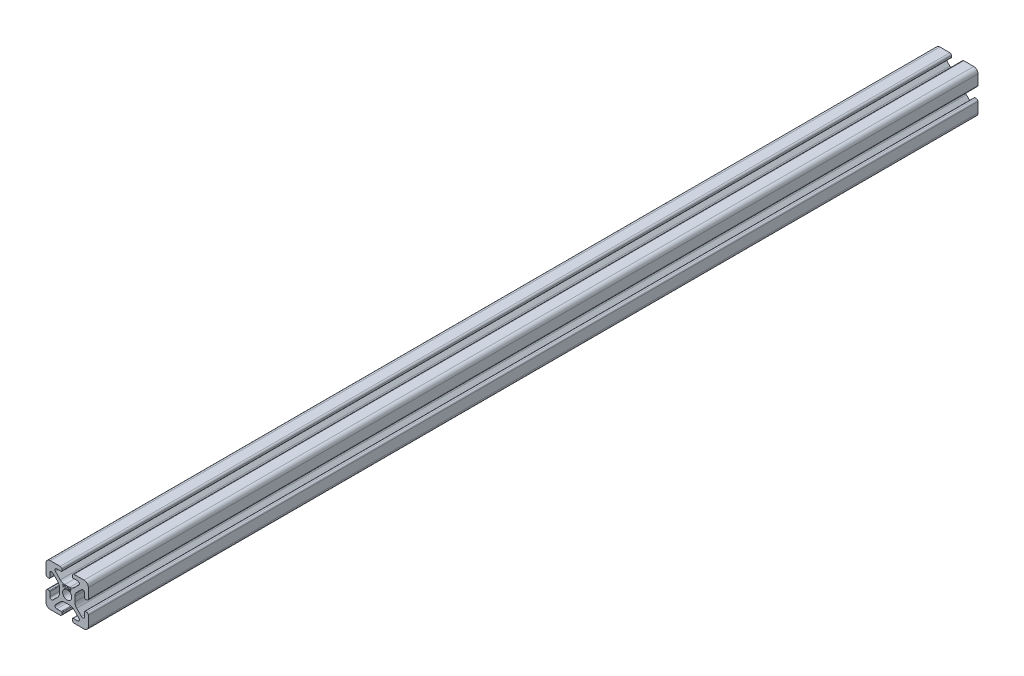
from build123d import *

# Parameters (mm, degrees)
SKETCH1_R           = 2.1463
BOSS_EXTRUDE1_DEPTH = 420
WRAP1_DEPTH         = 0.1


# Read off the part's stored shape, not the designer's step: Wrap1
with BuildPart() as part:
    # Sketch1 → Boss-Extrude1 (new body)
    with BuildSketch(Plane.XY):
        with BuildLine():
            Line((-9.9949, 7.9883), (-9.9949, 3.2893))
            ThreePointArc((-9.9949, 3.2893), (-9.76427588, 2.73252412), (-9.2075, 2.5019))
            Line((-9.2075, 2.5019), (-8.4963, 2.5019))
            ThreePointArc((-8.4963, 2.5019), (-8.280773853, 2.591173853), (-8.1915, 2.8067))
            Line((-8.1915, 2.8067), (-8.1915, 4.9149))
            ThreePointArc((-8.1915, 4.9149), (-7.674065253, 5.689295824), (-6.760603096, 5.507596904))
            Line((-6.760603096, 5.507596904), (-4.505765747, 3.252759555))
            ThreePointArc((-4.505765747, 3.252759555), (-3.856054457, 2.280397894), (-3.627906192, 1.133419111))
            Line((-3.627906192, 1.133419111), (-3.627906192, -1.133419111))
            ThreePointArc((-3.627906192, -1.133419111), (-3.856054457, -2.280397894), (-4.505765747, -3.252759555))
            Line((-4.505765747, -3.252759555), (-6.760603096, -5.507596904))
            ThreePointArc((-6.760603096, -5.507596904), (-7.674065253, -5.689295824), (-8.1915, -4.9149))
            Line((-8.1915, -4.9149), (-8.1915, -2.8067))
            ThreePointArc((-8.1915, -2.8067), (-8.280773853, -2.591173853), (-8.4963, -2.5019))
            Line((-8.4963, -2.5019), (-9.2075, -2.5019))
            ThreePointArc((-9.2075, -2.5019), (-9.76427588, -2.73252412), (-9.9949, -3.2893))
            Line((-9.9949, -3.2893), (-9.9949, -7.9883))
            ThreePointArc((-9.9949, -7.9883), (-9.407180467, -9.407180467), (-7.9883, -9.9949))
            Line((-7.9883, -9.9949), (-3.2893, -9.9949))
            ThreePointArc((-3.2893, -9.9949), (-2.73252412, -9.76427588), (-2.5019, -9.2075))
            Line((-2.5019, -9.2075), (-2.5019, -8.4963))
            ThreePointArc((-2.5019, -8.4963), (-2.591173853, -8.280773853), (-2.8067, -8.1915))
            Line((-2.8067, -8.1915), (-4.9149, -8.1915))
            ThreePointArc((-4.9149, -8.1915), (-5.689295824, -7.674065253), (-5.507596904, -6.760603096))
            Line((-5.507596904, -6.760603096), (-3.252759555, -4.505765747))
            ThreePointArc((-3.252759555, -4.505765747), (-2.280397894, -3.856054457), (-1.133419111, -3.627906192))
            Line((-1.133419111, -3.627906192), (1.133419111, -3.627906192))
            ThreePointArc((1.133419111, -3.627906192), (2.280397894, -3.856054457), (3.252759555, -4.505765747))
            Line((3.252759555, -4.505765747), (5.507596904, -6.760603096))
            ThreePointArc((5.507596904, -6.760603096), (5.689295824, -7.674065253), (4.9149, -8.1915))
            Line((4.9149, -8.1915), (2.8067, -8.1915))
            ThreePointArc((2.8067, -8.1915), (2.591173853, -8.280773853), (2.5019, -8.4963))
            Line((2.5019, -8.4963), (2.5019, -9.2075))
            ThreePointArc((2.5019, -9.2075), (2.73252412, -9.76427588), (3.2893, -9.9949))
            Line((3.2893, -9.9949), (7.9883, -9.9949))
            ThreePointArc((7.9883, -9.9949), (9.407180467, -9.407180467), (9.9949, -7.9883))
            Line((9.9949, -7.9883), (9.9949, -3.2893))
            ThreePointArc((9.9949, -3.2893), (9.76427588, -2.73252412), (9.2075, -2.5019))
            Line((9.2075, -2.5019), (8.4963, -2.5019))
            ThreePointArc((8.4963, -2.5019), (8.280773853, -2.591173853), (8.1915, -2.8067))
            Line((8.1915, -2.8067), (8.1915, -4.9149))
            ThreePointArc((8.1915, -4.9149), (7.674065253, -5.689295824), (6.760603096, -5.507596904))
            Line((6.760603096, -5.507596904), (4.505765747, -3.252759555))
            ThreePointArc((4.505765747, -3.252759555), (3.856054457, -2.280397894), (3.627906192, -1.133419111))
            Line((3.627906192, -1.133419111), (3.627906192, 1.133419111))
            ThreePointArc((3.627906192, 1.133419111), (3.856054457, 2.280397894), (4.505765747, 3.252759555))
            Line((4.505765747, 3.252759555), (6.760603096, 5.507596904))
            ThreePointArc((6.760603096, 5.507596904), (7.674065253, 5.689295824), (8.1915, 4.9149))
            Line((8.1915, 4.9149), (8.1915, 2.8067))
            ThreePointArc((8.1915, 2.8067), (8.280773853, 2.591173853), (8.4963, 2.5019))
            Line((8.4963, 2.5019), (9.2075, 2.5019))
            ThreePointArc((9.2075, 2.5019), (9.76427588, 2.73252412), (9.9949, 3.2893))
            Line((9.9949, 3.2893), (9.9949, 7.9883))
            ThreePointArc((9.9949, 7.9883), (9.407180467, 9.407180467), (7.9883, 9.9949))
            Line((7.9883, 9.9949), (3.2893, 9.9949))
            ThreePointArc((3.2893, 9.9949), (2.73252412, 9.76427588), (2.5019, 9.2075))
            Line((2.5019, 9.2075), (2.5019, 8.4963))
            ThreePointArc((2.5019, 8.4963), (2.591173853, 8.280773853), (2.8067, 8.1915))
            Line((2.8067, 8.1915), (4.9149, 8.1915))
            ThreePointArc((4.9149, 8.1915), (5.689295824, 7.674065253), (5.507596904, 6.760603096))
            Line((5.507596904, 6.760603096), (3.252759555, 4.505765747))
            ThreePointArc((3.252759555, 4.505765747), (2.280397894, 3.856054457), (1.133419111, 3.627906192))
            Line((1.133419111, 3.627906192), (-1.133419111, 3.627906192))
            ThreePointArc((-1.133419111, 3.627906192), (-2.280397894, 3.856054457), (-3.252759555, 4.505765747))
            Line((-3.252759555, 4.505765747), (-5.507596904, 6.760603096))
            ThreePointArc((-5.507596904, 6.760603096), (-5.689295824, 7.674065253), (-4.9149, 8.1915))
            Line((-4.9149, 8.1915), (-2.8067, 8.1915))
            ThreePointArc((-2.8067, 8.1915), (-2.591173853, 8.280773853), (-2.5019, 8.4963))
            Line((-2.5019, 8.4963), (-2.5019, 9.2075))
            ThreePointArc((-2.5019, 9.2075), (-2.73252412, 9.76427588), (-3.2893, 9.9949))
            Line((-3.2893, 9.9949), (-7.9883, 9.9949))
            ThreePointArc((-7.9883, 9.9949), (-9.407180467, 9.407180467), (-9.9949, 7.9883))
        make_face()
        Circle(SKETCH1_R, mode=Mode.SUBTRACT)
    extrude(amount=BOSS_EXTRUDE1_DEPTH)

    # Wrap1 outline → Wrap1 (add)
    # profile 1 of 5: a face of its own
    with BuildSketch(Plane.XY.offset(420)):
        with BuildLine():
            add(Edge.make_bspline(
                [(-1.158854167, 3.1463), (-1.145499559, 3.146255547), (-1.119857232, 3.146170192), (-1.083122011, 3.14569426), (-1.049742841, 3.144330158), (-1.019737172, 3.143156277), (-0.993105557, 3.141015722), (-0.969766331, 3.138969823), (-0.949826989, 3.136291634), (-0.937756745, 3.133804371), (-0.932291667, 3.132678205)],
                knots=[0, 0, 0, 0, 0.176257755, 0.338434414, 0.484822051, 0.617157578, 0.734698361, 0.837385184, 0.926372421, 1, 1, 1, 1], degree=3))
            Line((-1.158854167, 3.1463), (-1.358974359, 3.1463))
            Line((-1.358974359, 3.1463), (-1.358974359, 2.1463))
            Line((-1.358974359, 2.1463), (-1.269230769, 2.1463))
            Line((-1.269230769, 2.1463), (-1.269230769, 2.607838462))
            Line((-1.269230769, 2.607838462), (-1.196314103, 2.607838462))
            Line((-1.196314103, 2.607838462), (-0.828926282, 2.1463))
            Line((-0.828926282, 2.1463), (-0.717948718, 2.1463))
            Line((-0.717948718, 2.1463), (-1.085336538, 2.607838462))
            add(Edge.make_bspline(
                [(-0.730769231, 2.878872115), (-0.731188945, 2.8655478), (-0.732007915, 2.839548609), (-0.739643659, 2.801816929), (-0.752151236, 2.766619982), (-0.769386461, 2.734002085), (-0.791334883, 2.704599043), (-0.817713395, 2.678773199), (-0.848536712, 2.657161795), (-0.877230802, 2.64217528), (-0.902577717, 2.632577306), (-0.923444377, 2.625824061), (-0.946206371, 2.620606356), (-0.970645609, 2.615932033), (-0.996863797, 2.612402977), (-1.024798094, 2.609818236), (-1.054468423, 2.608202794), (-1.074851014, 2.607962221), (-1.085336538, 2.607838462)],
                knots=[0, 0, 0, 0, 0.078780236, 0.153720644, 0.22671353, 0.299191166, 0.371189997, 0.443006414, 0.516689173, 0.593217217, 0.633872918, 0.676989142, 0.722899506, 0.771958611, 0.824211323, 0.879378651, 0.937948119, 1, 1, 1, 1], degree=3))
            add(Edge.make_bspline(
                [(-0.932291667, 3.132678205), (-0.924975488, 3.130870558), (-0.910499206, 3.127293825), (-0.88965633, 3.119733939), (-0.869795094, 3.110985475), (-0.850998002, 3.100710127), (-0.833359204, 3.088831618), (-0.81669683, 3.075555012), (-0.800935269, 3.060952953), (-0.786711946, 3.044657284), (-0.773300788, 3.027561138), (-0.761989752, 3.009074351), (-0.752239329, 2.989742486), (-0.744476324, 2.969368938), (-0.738225475, 2.948151289), (-0.733817978, 2.925897347), (-0.731174781, 2.902708497), (-0.73090568, 2.886891951), (-0.730769231, 2.878872115)],
                knots=[0, 0, 0, 0, 0.064216843, 0.127063766, 0.188744538, 0.249132103, 0.309452533, 0.369826676, 0.430650142, 0.492351932, 0.554072106, 0.615689784, 0.676797703, 0.738439048, 0.80131691, 0.865184512, 0.931641324, 1, 1, 1, 1], degree=3))
        make_face()
        with BuildLine():
            add(Edge.make_bspline(
                [(-1.086137821, 2.709000321), (-1.077589238, 2.708996539), (-1.06101965, 2.708989208), (-1.037048032, 2.710130287), (-1.014728, 2.711428378), (-0.994144928, 2.713413905), (-0.975289621, 2.715972783), (-0.958171502, 2.719173636), (-0.94276263, 2.722902796), (-0.924791619, 2.728674689), (-0.904724039, 2.737819266), (-0.882915051, 2.751123694), (-0.864342954, 2.767857728), (-0.848652136, 2.786993002), (-0.836043727, 2.80803193), (-0.827154569, 2.830722321), (-0.821513871, 2.854491349), (-0.820848572, 2.870827951), (-0.820512821, 2.879072436)],
                knots=[0, 0, 0, 0, 0.07166815, 0.138913286, 0.20118457, 0.259124428, 0.312255041, 0.36068151, 0.405086143, 0.445101659, 0.51877778, 0.589461579, 0.658462242, 0.727283218, 0.796322487, 0.863174893, 0.930949381, 1, 1, 1, 1], degree=3))
            Line((-1.086137821, 2.709000321), (-1.269230769, 2.710402564))
            Line((-1.269230769, 2.710402564), (-1.269230769, 3.043735897))
            Line((-1.269230769, 3.043735897), (-1.081730769, 3.043735897))
            add(Edge.make_bspline(
                [(-0.820512821, 2.879072436), (-0.820856284, 2.887114314), (-0.821536902, 2.903050382), (-0.827093693, 2.926380642), (-0.836490659, 2.948399771), (-0.849154156, 2.969018195), (-0.864582486, 2.98773412), (-0.88267329, 3.003747592), (-0.902931917, 3.016961725), (-0.921866545, 3.025405834), (-0.938790606, 3.030582935), (-0.953484794, 3.034226124), (-0.970088074, 3.037153115), (-0.988681062, 3.039498276), (-1.009184385, 3.041513974), (-1.031701714, 3.042871625), (-1.056083651, 3.043675586), (-1.072982774, 3.043715326), (-1.081730769, 3.043735897)],
                knots=[0, 0, 0, 0, 0.068814296, 0.136364825, 0.204019354, 0.273063739, 0.34291332, 0.410965444, 0.479168767, 0.549308007, 0.587651576, 0.630646669, 0.678878786, 0.731934299, 0.791111423, 0.85528319, 0.925085939, 1, 1, 1, 1], degree=3))
        make_face(mode=Mode.SUBTRACT)
    # profile 2 of 5: a face of its own
    with BuildSketch(Plane.XY.offset(420)):
        with BuildLine():
            add(Edge.make_bspline(
                [(0.487179487, 2.646700641), (0.486736649, 2.628712799), (0.485863765, 2.593256679), (0.478386971, 2.541215695), (0.466660971, 2.491189782), (0.449919181, 2.443262452), (0.428426187, 2.397383148), (0.401953281, 2.35367259), (0.370770078, 2.312116448), (0.335282406, 2.273169972), (0.296596394, 2.237456409), (0.255102032, 2.20633673), (0.211732512, 2.179558409), (0.166776254, 2.15858654), (0.136050476, 2.147480684), (0.120869489, 2.142893898)],
                knots=[0, 0, 0, 0, 0.065226504, 0.128568996, 0.190320378, 0.251377989, 0.312387528, 0.373788704, 0.43643116, 0.500566755, 0.564686795, 0.627135518, 0.688455409, 0.749245746, 0.806772651, 0.806772651, 0.806772651, 0.806772651], degree=3))
            add(Edge.make_bspline(
                [(-0.044871795, 3.171941026), (-0.026355193, 3.171472032), (0.01001294, 3.170550888), (0.063462911, 3.163499716), (0.114490081, 3.151301033), (0.163510121, 3.135054467), (0.209936685, 3.113381785), (0.254119226, 3.087186028), (0.295952619, 3.056192755), (0.334873013, 3.020641547), (0.370489285, 2.98196056), (0.40186811, 2.940681157), (0.428165908, 2.897052928), (0.449761847, 2.851206976), (0.466704307, 2.803246985), (0.478395462, 2.75291727), (0.485863505, 2.70054393), (0.486736584, 2.664821969), (0.487179487, 2.646700641)],
                knots=[0, 0, 0, 0, 0.066570035, 0.130749041, 0.1934128, 0.254989399, 0.316113556, 0.377261758, 0.439400784, 0.502970589, 0.566524976, 0.628231103, 0.689090611, 0.749344669, 0.810169593, 0.871609824, 0.934869184, 1, 1, 1, 1], degree=3))
            add(Edge.make_bspline(
                [(-0.564102564, 2.641892949), (-0.563949811, 2.653787997), (-0.563646232, 2.677428032), (-0.559991463, 2.712532775), (-0.55468812, 2.747072963), (-0.547087573, 2.780950377), (-0.537147097, 2.814082087), (-0.525417946, 2.84669659), (-0.511092276, 2.878463369), (-0.494897805, 2.909532909), (-0.476823003, 2.939420882), (-0.456858503, 2.967672192), (-0.435705541, 2.994523905), (-0.412516, 3.019280192), (-0.388054158, 3.042661237), (-0.361923193, 3.064307727), (-0.334282552, 3.084414856), (-0.3050133, 3.102534953), (-0.27483665, 3.118923278), (-0.243729, 3.132986664), (-0.212112836, 3.145056967), (-0.17984008, 3.15484006), (-0.146996431, 3.162563499), (-0.113510206, 3.167822743), (-0.079408085, 3.171486833), (-0.056433422, 3.171788977), (-0.044871795, 3.171941026)],
                knots=[0, 0, 0, 0, 0.043208986, 0.085872872, 0.128120007, 0.170151964, 0.211917621, 0.253753003, 0.296006409, 0.338443357, 0.381015368, 0.422820479, 0.464089056, 0.505125849, 0.545974971, 0.586985211, 0.628338592, 0.670083802, 0.711991602, 0.753039155, 0.794049395, 0.834885543, 0.875498313, 0.9165473, 0.958003779, 1, 1, 1, 1], degree=3))
            add(Edge.make_bspline(
                [(-0.181004049, 2.138654068), (-0.185187206, 2.139746153), (-0.205650494, 2.145368804), (-0.241653164, 2.157869199), (-0.287608859, 2.179474122), (-0.331463168, 2.20581823), (-0.373040067, 2.237077413), (-0.411994852, 2.272553578), (-0.44763748, 2.311174021), (-0.478711587, 2.352555237), (-0.50506162, 2.395885367), (-0.526594, 2.44128466), (-0.543640989, 2.488533643), (-0.555270937, 2.537947494), (-0.562795495, 2.589244496), (-0.563662594, 2.624171038), (-0.564102564, 2.641892949)],
                knots=[0.176365138, 0.176365138, 0.176365138, 0.176365138, 0.192071954, 0.253459424, 0.314569588, 0.376279881, 0.439025654, 0.503267029, 0.567492823, 0.629704796, 0.690999649, 0.751451651, 0.812004364, 0.873149681, 0.935635484, 1, 1, 1, 1], degree=3))
            ThreePointArc((-0.181004049, 2.138654068), (-0.030141921, 2.146088338), (0.120869489, 2.142893898))
        make_face()
        with BuildLine():
            add(Edge.make_bspline(
                [(-0.474358974, 2.64229359), (-0.473994728, 2.627847241), (-0.473278143, 2.599426804), (-0.467004552, 2.557778763), (-0.45734113, 2.517753538), (-0.443096168, 2.479570135), (-0.425281707, 2.44290034), (-0.403274024, 2.408069453), (-0.3772, 2.37506806), (-0.347581849, 2.344126555), (-0.315203933, 2.315884897), (-0.280823153, 2.291095351), (-0.244807837, 2.270120994), (-0.207064064, 2.253033831), (-0.167793339, 2.239493906), (-0.12674261, 2.230214297), (-0.084185336, 2.224107024), (-0.055176577, 2.223520522), (-0.040464744, 2.223223077)],
                knots=[0, 0, 0, 0, 0.064503999, 0.126899322, 0.18774654, 0.248149733, 0.308586065, 0.369583005, 0.431826965, 0.496179723, 0.560667855, 0.623504455, 0.685260411, 0.746536822, 0.808327352, 0.870486188, 0.934316883, 1, 1, 1, 1], degree=3))
            add(Edge.make_bspline(
                [(-0.040464744, 3.069376923), (-0.049954639, 3.06926124), (-0.068843705, 3.06903098), (-0.096925002, 3.065997919), (-0.124636983, 3.061675093), (-0.151985372, 3.055508944), (-0.17885574, 3.047107786), (-0.205498552, 3.037438956), (-0.231670853, 3.025661501), (-0.257286241, 3.012355014), (-0.28211912, 2.997626751), (-0.30555132, 2.981349103), (-0.327643504, 2.963903802), (-0.34834158, 2.945250134), (-0.367584772, 2.925293105), (-0.38575183, 2.904335266), (-0.402114567, 2.881777583), (-0.417110447, 2.858231753), (-0.430529829, 2.833728444), (-0.442462788, 2.808525626), (-0.452223933, 2.782417715), (-0.460184612, 2.755687956), (-0.466784558, 2.728378682), (-0.470965679, 2.700282725), (-0.474032068, 2.671541265), (-0.474249167, 2.652117878), (-0.474358974, 2.64229359)],
                knots=[0, 0, 0, 0, 0.042023329, 0.083644911, 0.124983795, 0.166247461, 0.207701556, 0.249631071, 0.29174177, 0.334742875, 0.377460169, 0.419556319, 0.461044176, 0.502096284, 0.542890714, 0.583800819, 0.624863583, 0.666224689, 0.707399186, 0.748556678, 0.789654591, 0.830739726, 0.872070142, 0.913993395, 0.95649813, 1, 1, 1, 1], degree=3))
            add(Edge.make_bspline(
                [(0.397435897, 2.646900962), (0.397321294, 2.656591106), (0.397093956, 2.675813291), (0.394081821, 2.704230668), (0.38976728, 2.7320173), (0.383549364, 2.759064101), (0.375535034, 2.785377965), (0.36565294, 2.810934179), (0.353999997, 2.835827949), (0.340626219, 2.859997748), (0.325593126, 2.88319053), (0.3091662, 2.905362648), (0.291061814, 2.926097717), (0.271797236, 2.94590763), (0.250891269, 2.964369884), (0.228438613, 2.981490604), (0.204711848, 2.997682968), (0.179589781, 3.012290271), (0.153662937, 3.025780052), (0.127058949, 3.037337482), (0.100079206, 3.047158087), (0.072792317, 3.055534363), (0.044968609, 3.061650943), (0.016796086, 3.066001814), (-0.011686273, 3.069029925), (-0.030841479, 3.06926089), (-0.040464744, 3.069376923)],
                knots=[0, 0, 0, 0, 0.042915082, 0.085129971, 0.126473319, 0.167453038, 0.207976333, 0.248249378, 0.288749987, 0.329669857, 0.370537287, 0.411128564, 0.451818913, 0.492405877, 0.533485862, 0.575263062, 0.617440613, 0.660671688, 0.703940204, 0.746867522, 0.7890793, 0.831104042, 0.87323799, 0.91516577, 0.957380658, 1, 1, 1, 1], degree=3))
            add(Edge.make_bspline(
                [(-0.040464744, 2.223223077), (-0.030576315, 2.223358935), (-0.01096459, 2.223628383), (0.018205559, 2.226342291), (0.046850191, 2.230694254), (0.074929128, 2.236960155), (0.102410503, 2.244802214), (0.129409018, 2.254118708), (0.155637101, 2.265741909), (0.181425626, 2.278584181), (0.206110267, 2.293224226), (0.229674705, 2.308949412), (0.251524985, 2.326369017), (0.272207576, 2.344745535), (0.291529773, 2.364449492), (0.309360912, 2.385455269), (0.325640949, 2.407895457), (0.340631134, 2.431405573), (0.354003495, 2.455975931), (0.365654666, 2.481270125), (0.375539271, 2.50722587), (0.383518843, 2.533880605), (0.389771832, 2.561183705), (0.394080381, 2.589171727), (0.397094221, 2.617788682), (0.397321385, 2.637144069), (0.397435897, 2.646900962)],
                knots=[0, 0, 0, 0, 0.043633218, 0.086537777, 0.129177336, 0.171436324, 0.213415895, 0.255265955, 0.297369481, 0.339940748, 0.382347459, 0.423952947, 0.464871163, 0.505572294, 0.546002577, 0.586567975, 0.627064799, 0.668270684, 0.709549225, 0.750428154, 0.791096194, 0.832027145, 0.873135955, 0.914610764, 0.956955986, 1, 1, 1, 1], degree=3))
        make_face(mode=Mode.SUBTRACT)
    # profile 3 of 5: a face of its own
    with BuildSketch(Plane.XY.offset(420)):
        Polygon((-1.935897436, 3.043735897), (-1.538461538, 3.043735897), (-1.538461538, 3.1463), (-2.025641026, 3.1463), (-2.025641026, 2.1463), (-1.935897436, 2.1463), (-1.935897436, 2.633479487), (-1.538461538, 2.633479487), (-1.538461538, 2.73604359), (-1.935897436, 2.73604359), align=None)
    # profile 4 of 5: a face of its own
    with BuildSketch(Plane.XY.offset(420)):
        Polygon((1.91025641, 2.1463), (1.91025641, 3.043735897), (2.128205128, 3.043735897), (2.128205128, 3.1463), (1.602564103, 3.1463), (1.602564103, 3.043735897), (1.820512821, 3.043735897), (1.820512821, 2.1463), align=None)
    # profile 5 of 5: a face of its own
    with BuildSketch(Plane.XY.offset(420)):
        Polygon((0.782051282, 2.93155641), (1.441105769, 2.1463), (1.461538462, 2.1463), (1.461538462, 3.1463), (1.371794872, 3.1463), (1.371794872, 2.359240705), (0.711137821, 3.1463), (0.692307692, 3.1463), (0.692307692, 2.1463), (0.782051282, 2.1463), align=None)
    extrude(amount=WRAP1_DEPTH)


solid = part.part
